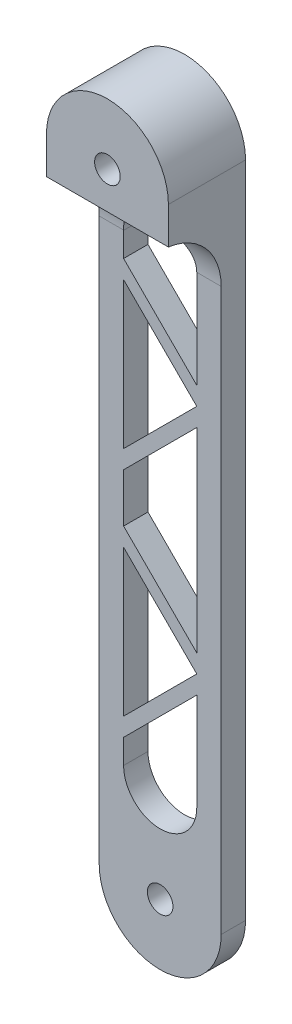
from build123d import *

# Parameters (mm, degrees)
CROQUIS1_R              = 2.1
SALIENTE_EXTRUIR1_DEPTH = 4
CROQUIS1_6_R            = 2.1
SALIENTE_EXTRUIR3_DEPTH = 12.65
REDONDEO1_R             = 10


with BuildPart() as part:
    # Croquis1 → Saliente-Extruir1 (new body)
    with BuildSketch(Plane.XY):
        with BuildLine():
            ThreePointArc((10, 54), (0, 64), (-10, 54))
            Line((-10, 54), (-10, -54))
            ThreePointArc((-10, -54), (0, -64), (10, -54))
            Line((10, -54), (10, 54))
        make_face()
        with Locations((0, 54)):
            Circle(CROQUIS1_R, mode=Mode.SUBTRACT)
        with BuildLine():
            Line((6, 38), (6, 22))
            Line((6, 22), (-6, 34))
            Line((-6, 34), (-6, 38))
            ThreePointArc((-6, 38), (0, 44), (6, 38))
        make_face(mode=Mode.SUBTRACT)
        Polygon((6, 16), (6, -16), (-6, -4), (-6, 4), align=None, mode=Mode.SUBTRACT)
        with BuildLine():
            Line((6, -22), (6, -38))
            ThreePointArc((6, -38), (0, -44), (-6, -38))
            Line((-6, -38), (-6, -34))
            Line((-6, -34), (6, -22))
        make_face(mode=Mode.SUBTRACT)
        Polygon((-6, -31), (-6, -7), (6, -19), align=None, mode=Mode.SUBTRACT)
        Polygon((-6, 7), (-6, 31), (6, 19), align=None, mode=Mode.SUBTRACT)
        with Locations((0, -54)):
            Circle(CROQUIS1_R, mode=Mode.SUBTRACT)
    extrude(amount=SALIENTE_EXTRUIR1_DEPTH)

    # Croquis1<6> → Saliente-Extruir3 (add)
    with BuildSketch(Plane.XY):
        with BuildLine():
            Line((10, 47.95), (10, 54))
            ThreePointArc((10, 54), (0, 64), (-10, 54))
            Line((-10, 54), (-10, 47.95))
            Line((-10, 47.95), (10, 47.95))
        make_face()
        with Locations((0, 54)):
            Circle(CROQUIS1_6_R, mode=Mode.SUBTRACT)
    extrude(amount=SALIENTE_EXTRUIR3_DEPTH)

    # Redondeo1
    # the kernel refuses this fillet: 10 mm, written as the material it adds along each edge
    with BuildSketch(Plane(origin=(10, 47.95, 4), x_dir=(0, 0, 1), z_dir=(-1, 0, 0))) as redondeo1_piece_1_section:
        with BuildLine():
            CenterArc((10, -9.908455985), REDONDEO1_R, 97.758619889, 82.241380111)
            Line((0, -9.908455985), (-0.2, -9.908455985))
            Line((-0.2, -9.908455985), (-0.2, 0))
            Line((-0.2, 0), (0, 0.2))
            ThreePointArc((0, 0.2), (4.325, 0.2), (8.623, 0.19816912))
            Line((8.623, 0.19816912), (8.65, 0))
        make_face()
    redondeo1_piece_1 = extrude(amount=20, mode=Mode.PRIVATE)
    redondeo1_piece_1 = redondeo1_piece_1 - Plane(origin=(0, 38, 6.259394391), x_dir=(-1, 0, 0), z_dir=(0, 0, -1)) * Cylinder(6, 80, mode=Mode.PRIVATE)
    add(redondeo1_piece_1)


solid = part.part
